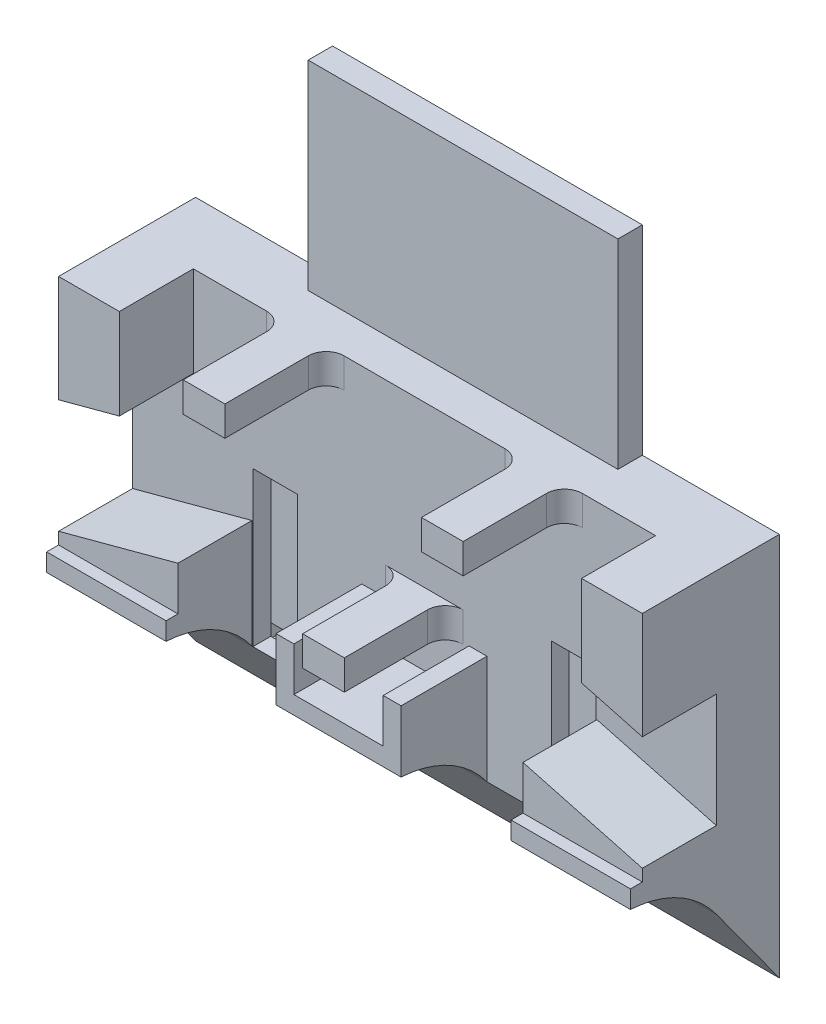
from build123d import *
from OCP.BRepAlgoAPI import BRepAlgoAPI_Cut
from OCP.TopTools import TopTools_ListOfShape
from build123d.topology import SkipClean

# Parameters (mm, degrees)
CROQUIS1_W               = 98
CROQUIS1_H               = 98
SALIENTE_EXTRUIR2_DEPTH  = 25
CORTAR_EXTRUIR1_DEPTH    = 113.383272777
CROQUIS4_W               = 23
CROQUIS4_H               = 35
CORTAR_EXTRUIR2_DEPTH    = 74.668174947
CROQUIS5_W               = 52
CROQUIS5_H               = 35
CORTAR_EXTRUIR3_DEPTH    = 20
CROQUIS6_W               = 18.3
CROQUIS6_H               = 10.893215352
CORTAR_EXTRUIR4_DEPTH    = 14.419865
CROQUIS7_W               = 57.6
CROQUIS7_H               = 37.544478749
CORTAR_EXTRUIR5_DEPTH    = 14.419865
CROQUIS8_W               = 98
CROQUIS8_H               = 37.544478749
CORTAR_EXTRUIR6_DEPTH    = 2
CORTAR_EXTRUIR7_DEPTH    = 12.419865
CROQUIS10_W              = 10
CROQUIS10_H              = 14.511396986
CORTAR_EXTRUIR8_DEPTH    = 12.419865
CROQUIS13_W              = 7.5
CROQUIS13_H              = 25.893215352
CORTAR_EXTRUIR9_DEPTH    = 3
CROQUIS16_W              = 7.5
CROQUIS16_H              = 2
CORTAR_EXTRUIR10_DEPTH   = 72.452443713
CORTAR_EXTRUIR11_DEPTH   = 3
SALIENTE_EXTRUIR4_DEPTH  = 1.5
CROQUIS24_W              = 52
CROQUIS24_H              = 33.5
SALIENTE_EXTRUIR7_DEPTH  = 1.1
CORTAR_EXTRUIR12_START   = -14.419865
CROQUIS25_W              = 0.16
CROQUIS25_H              = 18.305789039
CORTAR_EXTRUIR12_DEPTH   = 14.419865
CROQUIS26_W              = 3
CROQUIS26_H              = 7.369701816
SALIENTE_EXTRUIR8_DEPTH  = 25
CORTAR_EXTRUIR13_DEPTH   = 12.419865
CROQUIS28_W              = 52
CROQUIS28_H              = 33.5
CORTAR_EXTRUIR14_DEPTH   = 2
CROQUIS29_W              = 24.7
CROQUIS29_H              = 3
SALIENTE_EXTRUIR10_DEPTH = 3
CROQUIS30_W              = 17.2
CROQUIS30_H              = 3.1
CORTAR_EXTRUIR15_DEPTH   = 3
SALIENTE_EXTRUIR11_DEPTH = 3
CROQUIS33_W              = 4
CROQUIS33_H              = 3
CORTAR_EXTRUIR16_DEPTH   = 3
SALIENTE_EXTRUIR12_START = -22.94
SALIENTE_EXTRUIR12_DEPTH = 3
SALIENTE_EXTRUIR13_START = -3
SALIENTE_EXTRUIR13_DEPTH = 3
SALIENTE_EXTRUIR14_START = -3
SALIENTE_EXTRUIR14_DEPTH = 3
CORTAR_EXTRUIR17_DEPTH   = 12.419865
SALIENTE_EXTRUIR15_START = -7.580135
CROQUIS39_W              = 7.5
CROQUIS39_H              = 2
SALIENTE_EXTRUIR15_DEPTH = 7.580135
CROQUIS40_W              = 24.7
CROQUIS40_H              = 2
SALIENTE_EXTRUIR16_DEPTH = 3
CROQUIS41_W              = 24.7
CROQUIS41_H              = 2
CORTAR_EXTRUIR18_DEPTH   = 3
CROQUIS42_W              = 7.7
CROQUIS42_H              = 2.5
CORTAR_EXTRUIR19_DEPTH   = 7.580135
SALIENTE_EXTRUIR17_START = -5
SALIENTE_EXTRUIR17_DEPTH = 5
CROQUIS44_W              = 16.949641927
CROQUIS44_H              = 2
CORTAR_EXTRUIR20_DEPTH   = 12.5
CROQUIS45_W              = 24.7
CROQUIS45_H              = 0.54
CORTAR_EXTRUIR21_DEPTH   = 3
SALIENTE_EXTRUIR18_START = -5
SALIENTE_EXTRUIR18_DEPTH = 2
SALIENTE_EXTRUIR19_START = -7
SALIENTE_EXTRUIR19_DEPTH = 4
CROQUIS49_W              = 16.949641927
CROQUIS49_H              = 2
CORTAR_EXTRUIR22_DEPTH   = 12.5


with BuildPart() as part:
    # Croquis1 → Saliente-Extruir2 (new body)
    with BuildSketch(Plane.XY):
        Rectangle(CROQUIS1_W, CROQUIS1_H)
    extrude(amount=SALIENTE_EXTRUIR2_DEPTH)

    # Croquis3 → Cortar-Extruir1 (cut, through all)
    with BuildSketch(Plane(origin=(49, 0, 0), x_dir=(0, 0, -1), z_dir=(1, 0, 0))):
        with BuildLine():
            Line((0, -49), (-10.580134541, -34.437694101))
            ThreePointArc((-10.580134541, -34.437694101), (-16.90412089, -28.872579006), (-25, -26.544478749))
            Line((-25, -26.544478749), (-25, -49))
            Line((-25, -49), (0, -49))
        make_face()
    extrude(amount=-CORTAR_EXTRUIR1_DEPTH, mode=Mode.SUBTRACT)

    # Croquis4 → Cortar-Extruir2 (cut, through all)
    with BuildSketch(Plane.XY.offset(25)):
        with Locations((-37.5, 31.5)):
            Rectangle(CROQUIS4_W, CROQUIS4_H)
        with Locations((37.5, 31.5)):
            Rectangle(CROQUIS4_W, CROQUIS4_H)
    extrude(amount=-CORTAR_EXTRUIR2_DEPTH, mode=Mode.SUBTRACT)

    # Croquis5 → Cortar-Extruir3 (cut)
    with BuildSketch(Plane.XY.offset(25)):
        with Locations((0, 31.5)):
            Rectangle(CROQUIS5_W, CROQUIS5_H)
    extrude(amount=-CORTAR_EXTRUIR3_DEPTH, mode=Mode.SUBTRACT)

    # Croquis6 → Cortar-Extruir4 (cut)
    with BuildSketch(Plane.XY.offset(25)):
        with Locations((-19.65, -28.991086425)):
            Rectangle(CROQUIS6_W, CROQUIS6_H)
        with Locations((19.65, -28.991086425)):
            Rectangle(CROQUIS6_W, CROQUIS6_H)
    extrude(amount=-CORTAR_EXTRUIR4_DEPTH, mode=Mode.SUBTRACT)

    # Croquis7 → Cortar-Extruir5 (cut)
    with BuildSketch(Plane.XY.offset(25)):
        with Locations((0, -4.772239375)):
            Rectangle(CROQUIS7_W, CROQUIS7_H)
    extrude(amount=-CORTAR_EXTRUIR5_DEPTH, mode=Mode.SUBTRACT)

    # Croquis8 → Cortar-Extruir6 (cut)
    with BuildSketch(Plane.XY.offset(25)):
        with Locations((0, -4.772239375)):
            Rectangle(CROQUIS8_W, CROQUIS8_H)
    extrude(amount=-CORTAR_EXTRUIR6_DEPTH, mode=Mode.SUBTRACT)

    # Croquis9 → Cortar-Extruir7 (cut)
    with BuildSketch(Plane.XY.offset(23)):
        Polygon((-49, -3.244478749), (-49, -21.544478749), (-28.8, -16.131905062), (-28.8, 2.168094938), align=None)
        Polygon((28.8, -16.131905062), (49, -21.544478749), (49, -3.244478749), (28.8, 2.168094938), align=None)
    extrude(amount=-CORTAR_EXTRUIR7_DEPTH, mode=Mode.SUBTRACT)

    # Croquis10 → Cortar-Extruir8 (cut)
    with BuildSketch(Plane.XY.offset(23)):
        with Locations((-33.8, 6.744301507)):
            Rectangle(CROQUIS10_W, CROQUIS10_H)
        with Locations((33.8, 6.744301507)):
            Rectangle(CROQUIS10_W, CROQUIS10_H)
    extrude(amount=-CORTAR_EXTRUIR8_DEPTH, mode=Mode.SUBTRACT)


with BuildPart() as cortar_extruir9_tool:
    # Croquis13 → Cortar-Extruir9 (new body)
    with BuildSketch(Plane.XY.offset(10.580134541)):
        with Locations((-25.05, -21.491086425)):
            Rectangle(CROQUIS13_W, CROQUIS13_H)
        with Locations((25.05, -21.491086425)):
            Rectangle(CROQUIS13_W, CROQUIS13_H)
    extrude(amount=-CORTAR_EXTRUIR9_DEPTH)


with BuildPart() as part_1:
    add(part.part)

    # Cortar-Extruir9: cut by cortar_extruir9_tool, with a tolerance
    cortar_extruir9_stock = TopTools_ListOfShape()
    cortar_extruir9_stock.Append(part_1.part.wrapped)
    cortar_extruir9_tools = TopTools_ListOfShape()
    cortar_extruir9_tools.Append(cortar_extruir9_tool.part.wrapped)
    cortar_extruir9_cut = BRepAlgoAPI_Cut()
    cortar_extruir9_cut.SetArguments(cortar_extruir9_stock)
    cortar_extruir9_cut.SetTools(cortar_extruir9_tools)
    cortar_extruir9_cut.SetFuzzyValue(0.00001)
    cortar_extruir9_cut.Build()
    add(Compound.cast(cortar_extruir9_cut.Shape()).solids(), mode=Mode.REPLACE)

    # Croquis16 → Cortar-Extruir10 (cut, through all)
    with BuildSketch(Plane.XY.offset(7.580134541)):
        with Locations((-25.05, -33.437694101)):
            Rectangle(CROQUIS16_W, CROQUIS16_H)
        with Locations((25.05, -33.437694101)):
            Rectangle(CROQUIS16_W, CROQUIS16_H)
    extrude(amount=-CORTAR_EXTRUIR10_DEPTH, mode=Mode.SUBTRACT)

    # Croquis17 → Cortar-Extruir11 (cut)
    with BuildSketch(Plane(origin=(0, 0, 0), x_dir=(-1, 0, 0), z_dir=(0, 0, -1))):
        Polygon((-46, -44.7), (-21.3, -44.7), (-21.3, -37), (-21.3, -34.437694101), (-28.8, -34.437694101), (-28.8, -37), (-46, -37), align=None)
        Polygon((46, -44.7), (21.3, -44.7), (21.3, -37), (21.3, -34.437694101), (28.8, -34.437694101), (28.8, -37), (46, -37), align=None)
    extrude(amount=-CORTAR_EXTRUIR11_DEPTH, mode=Mode.SUBTRACT)

    # Croquis21 → Saliente-Extruir4 (add)
    with BuildSketch(Plane(origin=(0, 14, 0), x_dir=(1, 0, 0), z_dir=(0, 1, 0))):
        Polygon((-49, 0), (-49, -23), (-38.8, -23), (-38.8, -10.580134541), (38.8, -10.580134541), (38.8, -23), (49, -23), (49, 0), (26, 0), (26, -5), (-26, -5), (-26, 0), align=None)
    extrude(amount=SALIENTE_EXTRUIR4_DEPTH)

    # Croquis24 → Saliente-Extruir7 (add)
    with BuildSketch(Plane.XY.offset(5)):
        with Locations((0, 32.25)):
            Rectangle(CROQUIS24_W, CROQUIS24_H)
    extrude(amount=SALIENTE_EXTRUIR7_DEPTH)

    # Croquis25 → Cortar-Extruir12 (cut)
    with BuildSketch(Plane.XY.offset(25).offset(CORTAR_EXTRUIR12_START)):
        with Locations((28.88, -25.284799582)):
            Rectangle(CROQUIS25_W, CROQUIS25_H)
        with Locations((-28.88, -25.284799582)):
            Rectangle(CROQUIS25_W, CROQUIS25_H)
    extrude(amount=CORTAR_EXTRUIR12_DEPTH, mode=Mode.SUBTRACT)

    # Croquis26 → Saliente-Extruir8 (add)
    with BuildSketch(Plane.XY.offset(25)):
        with Locations((-9, -19.859627841)):
            Rectangle(CROQUIS26_W, CROQUIS26_H)
        with Locations((9, -19.859627841)):
            Rectangle(CROQUIS26_W, CROQUIS26_H)
    extrude(amount=-SALIENTE_EXTRUIR8_DEPTH)

    # Croquis27 → Cortar-Extruir13 (cut)
    with BuildSketch(Plane.XY.offset(23)):
        Polygon((49, -3.07883456), (38.8, -0.345752797), (38.8, -0.511396986), (49, -3.244478749), align=None)
        Polygon((-38.8, -0.511396986), (-49, -3.244478749), (-49, -3.07883456), (-38.8, -0.345752797), align=None)
    extrude(amount=-CORTAR_EXTRUIR13_DEPTH, mode=Mode.SUBTRACT)

    # Croquis28 → Cortar-Extruir14 (cut)
    with BuildSketch(Plane.XY.offset(6.1)):
        with Locations((0, 32.25)):
            Rectangle(CROQUIS28_W, CROQUIS28_H)
    extrude(amount=-CORTAR_EXTRUIR14_DEPTH, mode=Mode.SUBTRACT)

    # Croquis29 → Saliente-Extruir10 (add)
    with BuildSketch(Plane(origin=(0, 0, 0), x_dir=(-1, 0, 0), z_dir=(0, 0, -1))):
        with Locations((-33.65, -43.2)):
            Rectangle(CROQUIS29_W, CROQUIS29_H)
        with Locations((33.65, -43.2)):
            Rectangle(CROQUIS29_W, CROQUIS29_H)
    extrude(amount=-SALIENTE_EXTRUIR10_DEPTH)

    # Croquis30 → Cortar-Extruir15 (cut)
    with BuildSketch(Plane(origin=(0, 0, 0), x_dir=(-1, 0, 0), z_dir=(0, 0, -1))):
        with Locations((-37.4, -35.45)):
            Rectangle(CROQUIS30_W, CROQUIS30_H)
        with Locations((37.4, -35.45)):
            Rectangle(CROQUIS30_W, CROQUIS30_H)
    extrude(amount=-CORTAR_EXTRUIR15_DEPTH, mode=Mode.SUBTRACT)

    # Croquis32 → Saliente-Extruir11 (add)
    with BuildSketch(Plane(origin=(0, 15.5, 0), x_dir=(1, 0, 0), z_dir=(0, 1, 0))):
        with BuildLine():
            Line((22, -13.580134541), (22, -30.580134541))
            Line((22, -30.580134541), (18, -30.580134541))
            Line((18, -30.580134541), (18, -13.580134541))
            ThreePointArc((18, -13.580134541), (17.121320344, -11.458814198), (15, -10.580134541))
            Line((15, -10.580134541), (25, -10.580134541))
            ThreePointArc((25, -10.580134541), (22.878679656, -11.458814198), (22, -13.580134541))
        make_face()
        with BuildLine():
            Line((-25, -10.580134541), (-15, -10.580134541))
            ThreePointArc((-15, -10.580134541), (-17.121320344, -11.458814198), (-18, -13.580134541))
            Line((-18, -13.580134541), (-18, -30.580134541))
            Line((-18, -30.580134541), (-22, -30.580134541))
            Line((-22, -30.580134541), (-22, -13.580134541))
            ThreePointArc((-22, -13.580134541), (-22.878679656, -11.458814198), (-25, -10.580134541))
        make_face()
    extrude(amount=-SALIENTE_EXTRUIR11_DEPTH)

    # Croquis33 → Cortar-Extruir16 (cut)
    with BuildSketch(Plane(origin=(0, 15.5, 0), x_dir=(1, 0, 0), z_dir=(0, 1, 0))):
        with Locations((20, -29.080134541)):
            Rectangle(CROQUIS33_W, CROQUIS33_H)
        with Locations((-20, -29.080134541)):
            Rectangle(CROQUIS33_W, CROQUIS33_H)
    extrude(amount=-CORTAR_EXTRUIR16_DEPTH, mode=Mode.SUBTRACT)

    # Croquis34 → Saliente-Extruir12 (add)
    with BuildSketch(Plane(origin=(0, 15.5, 0), x_dir=(1, 0, 0), z_dir=(0, 1, 0)).offset(SALIENTE_EXTRUIR12_START)):
        with BuildLine():
            Line((-2, -13.580134541), (-2, -27.529776468))
            Line((-2, -27.529776468), (2, -27.529776468))
            Line((2, -27.529776468), (2, -13.580134541))
            ThreePointArc((2, -13.580134541), (2.878679656, -11.458814198), (5, -10.580134541))
            Line((5, -10.580134541), (-5, -10.580134541))
            ThreePointArc((-5, -10.580134541), (-2.878679656, -11.458814198), (-2, -13.580134541))
        make_face()
    extrude(amount=-SALIENTE_EXTRUIR12_DEPTH)

    # Croquis35 → Saliente-Extruir13 (add)
    with BuildSketch(Plane(origin=(0, 15.5, 0), x_dir=(1, 0, 0), z_dir=(0, 1, 0)).offset(SALIENTE_EXTRUIR13_START)):
        with BuildLine():
            Line((23.5, -27.580134541), (23.5, -13.580134541))
            ThreePointArc((23.5, -13.580134541), (24.378679656, -11.458814198), (26.5, -10.580134541))
            Line((26.5, -10.580134541), (22, -10.580134541))
            Line((22, -10.580134541), (22, -27.580134541))
            Line((22, -27.580134541), (23.5, -27.580134541))
        make_face()
        with BuildLine():
            Line((18, -10.580134541), (13.5, -10.580134541))
            ThreePointArc((13.5, -10.580134541), (15.621320344, -11.458814198), (16.5, -13.580134541))
            Line((16.5, -13.580134541), (16.5, -27.580134541))
            Line((16.5, -27.580134541), (18, -27.580134541))
            Line((18, -27.580134541), (18, -10.580134541))
        make_face()
        with BuildLine():
            Line((-22, -10.580134541), (-26.5, -10.580134541))
            ThreePointArc((-26.5, -10.580134541), (-24.378679656, -11.458814198), (-23.5, -13.580134541))
            Line((-23.5, -13.580134541), (-23.5, -27.580134541))
            Line((-23.5, -27.580134541), (-22, -27.580134541))
            Line((-22, -27.580134541), (-22, -10.580134541))
        make_face()
        with BuildLine():
            ThreePointArc((-13.5, -10.580134541), (-15.621320344, -11.458814198), (-16.5, -13.580134541))
            Line((-16.5, -13.580134541), (-16.5, -27.580134541))
            Line((-16.5, -27.580134541), (-18, -27.580134541))
            Line((-18, -27.580134541), (-18, -10.580134541))
            Line((-18, -10.580134541), (-13.5, -10.580134541))
        make_face()
    extrude(amount=SALIENTE_EXTRUIR13_DEPTH)

    # Croquis36 → Saliente-Extruir14 (add)
    with BuildSketch(Plane(origin=(0, -7.44, 0), x_dir=(1, 0, 0), z_dir=(0, 1, 0)).offset(SALIENTE_EXTRUIR14_START)):
        with BuildLine():
            Line((2, -27.529776468), (3.5, -27.529776468))
            Line((3.5, -27.529776468), (3.5, -13.580134541))
            ThreePointArc((3.5, -13.580134541), (4.378679656, -11.458814198), (6.5, -10.580134541))
            Line((6.5, -10.580134541), (2, -10.580134541))
            Line((2, -10.580134541), (2, -27.529776468))
        make_face()
        with BuildLine():
            Line((-2, -27.529776468), (-3.5, -27.529776468))
            Line((-3.5, -27.529776468), (-3.5, -13.580134541))
            ThreePointArc((-3.5, -13.580134541), (-4.378679656, -11.458814198), (-6.5, -10.580134541))
            Line((-6.5, -10.580134541), (-2, -10.580134541))
            Line((-2, -10.580134541), (-2, -27.529776468))
        make_face()
    extrude(amount=SALIENTE_EXTRUIR14_DEPTH)

    # Croquis37 → Cortar-Extruir17 (cut)
    with BuildSketch(Plane.XY.offset(23)):
        Polygon((-49, -2.436963328), (-38.8, 0.296118434), (-38.8, -0.345752797), (-49, -3.07883456), align=None)
        Polygon((49, -3.07883456), (38.8, -0.345752797), (38.8, 0.296118434), (49, -2.436963328), align=None)
    extrude(amount=-CORTAR_EXTRUIR17_DEPTH, mode=Mode.SUBTRACT)

    # Croquis39 → Saliente-Extruir15 (add)
    with BuildSketch(Plane(origin=(0, 0, 0), x_dir=(-1, 0, 0), z_dir=(0, 0, -1)).offset(SALIENTE_EXTRUIR15_START)):
        with Locations((-25.05, -33.437694101)):
            Rectangle(CROQUIS39_W, CROQUIS39_H)
        with Locations((25.05, -33.437694101)):
            Rectangle(CROQUIS39_W, CROQUIS39_H)
    extrude(amount=SALIENTE_EXTRUIR15_DEPTH)

    # Croquis40 → Saliente-Extruir16 (add)
    with BuildSketch(Plane(origin=(0, 0, 0), x_dir=(-1, 0, 0), z_dir=(0, 0, -1))):
        with Locations((33.65, -40.7)):
            Rectangle(CROQUIS40_W, CROQUIS40_H)
        with Locations((-33.65, -40.7)):
            Rectangle(CROQUIS40_W, CROQUIS40_H)
    extrude(amount=-SALIENTE_EXTRUIR16_DEPTH)

    # Croquis41 → Cortar-Extruir18 (cut)
    with BuildSketch(Plane(origin=(0, 0, 0), x_dir=(-1, 0, 0), z_dir=(0, 0, -1))):
        with Locations((-33.65, -33.437694101)):
            Rectangle(CROQUIS41_W, CROQUIS41_H)
        with Locations((33.65, -33.437694101)):
            Rectangle(CROQUIS41_W, CROQUIS41_H)
    extrude(amount=-CORTAR_EXTRUIR18_DEPTH, mode=Mode.SUBTRACT)

    # Croquis42 → Cortar-Extruir19 (cut)
    with BuildSketch(Plane(origin=(0, 0, 0), x_dir=(-1, 0, 0), z_dir=(0, 0, -1))):
        with Locations((25.15, -33.687694101)):
            Rectangle(CROQUIS42_W, CROQUIS42_H)
        with Locations((-25.15, -33.687694101)):
            Rectangle(CROQUIS42_W, CROQUIS42_H)
    extrude(amount=-CORTAR_EXTRUIR19_DEPTH, mode=Mode.SUBTRACT)

    # Croquis43 → Saliente-Extruir17 (add)
    with BuildSketch(Plane(origin=(0, -7.44, 0), x_dir=(1, 0, 0), z_dir=(0, 1, 0)).offset(SALIENTE_EXTRUIR17_START)):
        with BuildLine():
            Line((-3.5, -27.529776468), (3.5, -27.529776468))
            Line((3.5, -27.529776468), (3.5, -13.580134541))
            ThreePointArc((3.5, -13.580134541), (4.378679656, -11.458814198), (6.5, -10.580134541))
            Line((6.5, -10.580134541), (-6.5, -10.580134541))
            ThreePointArc((-6.5, -10.580134541), (-4.378679656, -11.458814198), (-3.5, -13.580134541))
            Line((-3.5, -13.580134541), (-3.5, -27.529776468))
        make_face()
    extrude(amount=SALIENTE_EXTRUIR17_DEPTH)

    # Croquis44 → Cortar-Extruir20 (cut, symmetric)
    with SkipClean():  # the faces are left unmerged after this step: merging them gives an invalid solid
        with BuildSketch(Plane(origin=(3.5, 0, 0), x_dir=(0, 0, -1), z_dir=(1, 0, 0))):
            with Locations((-19.054955505, -8.44)):
                Rectangle(CROQUIS44_W, CROQUIS44_H)
        extrude(amount=CORTAR_EXTRUIR20_DEPTH, both=True, mode=Mode.SUBTRACT)

    # Croquis45 → Cortar-Extruir21 (cut)
    with SkipClean():  # the faces are left unmerged after this step: merging them gives an invalid solid
        with BuildSketch(Plane(origin=(0, 0, 0), x_dir=(-1, 0, 0), z_dir=(0, 0, -1))):
            with Locations((-33.65, -32.167694101)):
                Rectangle(CROQUIS45_W, CROQUIS45_H)
            with Locations((33.65, -32.167694101)):
                Rectangle(CROQUIS45_W, CROQUIS45_H)
        extrude(amount=-CORTAR_EXTRUIR21_DEPTH, mode=Mode.SUBTRACT)

    # Croquis47 → Saliente-Extruir18 (add)
    with SkipClean():  # the faces are left unmerged after this step: merging them gives an invalid solid
        with BuildSketch(Plane(origin=(0, 15.5, 0), x_dir=(1, 0, 0), z_dir=(0, 1, 0)).offset(SALIENTE_EXTRUIR18_START)):
            with BuildLine():
                Line((-23.5, -27.580134541), (-16.5, -27.580134541))
                Line((-16.5, -27.580134541), (-16.5, -13.580134541))
                ThreePointArc((-16.5, -13.580134541), (-15.621320344, -11.458814198), (-13.5, -10.580134541))
                Line((-13.5, -10.580134541), (-26.5, -10.580134541))
                ThreePointArc((-26.5, -10.580134541), (-24.378679656, -11.458814198), (-23.5, -13.580134541))
                Line((-23.5, -13.580134541), (-23.5, -27.580134541))
            make_face()
            with BuildLine():
                Line((16.5, -27.580134541), (16.5, -13.580134541))
                ThreePointArc((16.5, -13.580134541), (15.621320344, -11.458814198), (13.5, -10.580134541))
                Line((13.5, -10.580134541), (26.5, -10.580134541))
                ThreePointArc((26.5, -10.580134541), (24.378679656, -11.458814198), (23.5, -13.580134541))
                Line((23.5, -13.580134541), (23.5, -27.580134541))
                Line((23.5, -27.580134541), (16.5, -27.580134541))
            make_face()
        extrude(amount=SALIENTE_EXTRUIR18_DEPTH)

    # Croquis48 → Saliente-Extruir19 (add)
    with SkipClean():  # the faces are left unmerged after this step: merging them gives an invalid solid
        with BuildSketch(Plane(origin=(0, -9.44, 0), x_dir=(1, 0, 0), z_dir=(0, 1, 0)).offset(SALIENTE_EXTRUIR19_START)):
            with BuildLine():
                Line((3.5, -27.529776468), (-3.5, -27.529776468))
                Line((-3.5, -27.529776468), (-3.5, -13.580134541))
                ThreePointArc((-3.5, -13.580134541), (-4.378679656, -11.458814198), (-6.5, -10.580134541))
                Line((-6.5, -10.580134541), (6.5, -10.580134541))
                ThreePointArc((6.5, -10.580134541), (4.378679656, -11.458814198), (3.5, -13.580134541))
                Line((3.5, -13.580134541), (3.5, -27.529776468))
            make_face()
        extrude(amount=SALIENTE_EXTRUIR19_DEPTH)

    # Croquis49 → Cortar-Extruir22 (cut, symmetric)
    with SkipClean():  # the faces are left unmerged after this step: merging them gives an invalid solid
        with BuildSketch(Plane(origin=(3.5, 0, 0), x_dir=(0, 0, -1), z_dir=(1, 0, 0))):
            with Locations((-19.054955505, -10.44)):
                Rectangle(CROQUIS49_W, CROQUIS49_H)
        extrude(amount=CORTAR_EXTRUIR22_DEPTH, both=True, mode=Mode.SUBTRACT)


solid = part_1.part
